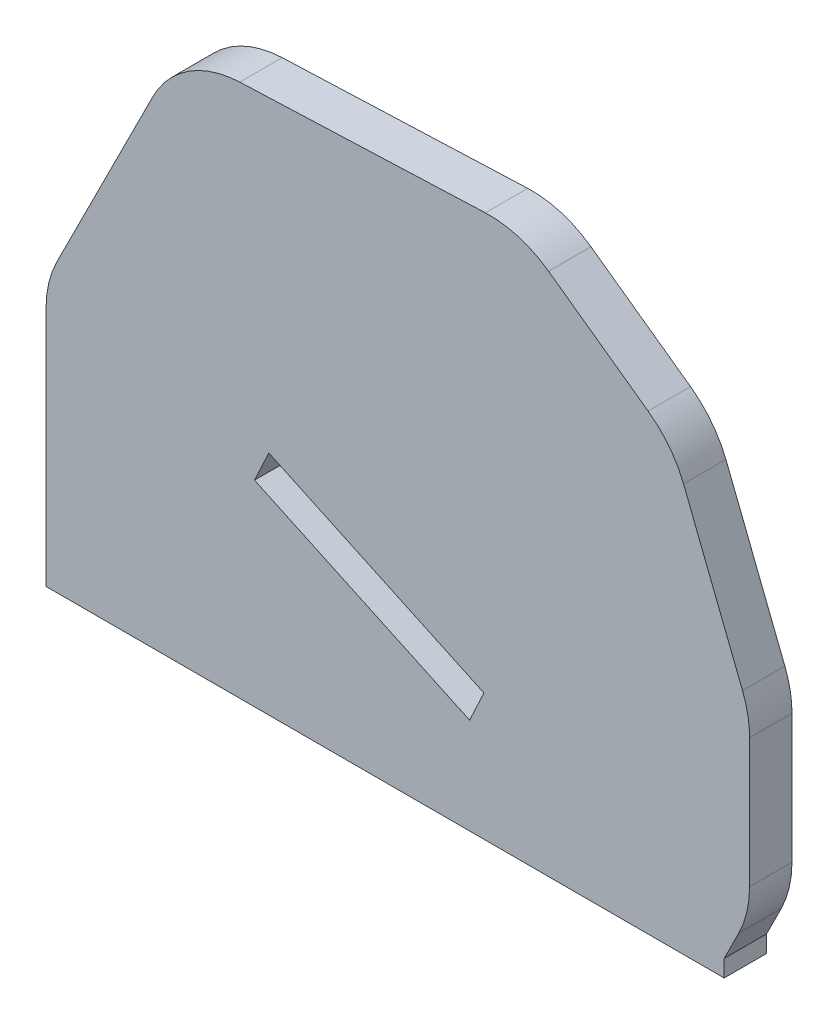
from build123d import *

# Parameters (mm, degrees)
BOSS_EXTRUDE1_DEPTH = 0.125
FILLET1_R           = 0.6


with BuildPart() as part:
    # frame_outline → Boss-Extrude1 (new, symmetric)
    with BuildSketch(Plane.XY):
        Polygon((0, 0), (4, 0), (4, 0.1), (4.15, 0.4), (4.15, 1.416096183), (3.695232724, 2.568743907), (2.797078859, 3.212298026), (0.789408464, 3.133982378), (0, 1.562826413), align=None)
        Polygon((1.229765114, 1.157816865), (2.498596016, 0.566151298), (2.583119668, 0.747412856), (1.314288766, 1.339078422), align=None, mode=Mode.SUBTRACT)
    extrude(amount=BOSS_EXTRUDE1_DEPTH, both=True)

    # Fillet1
    fillet1_edges = [part.edges().sort_by_distance(p)[0] for p in [
        (4.15, 0.4, 0),
        (4.15, 1.416096183, 0),
        (3.695232724, 2.568743907, 0),
        (2.797078859, 3.212298026, 0),
        (0.789408464, 3.133982378, 0),
        (0, 1.562826413, 0),
    ]]
    fillet(fillet1_edges, radius=FILLET1_R)


solid = part.part
